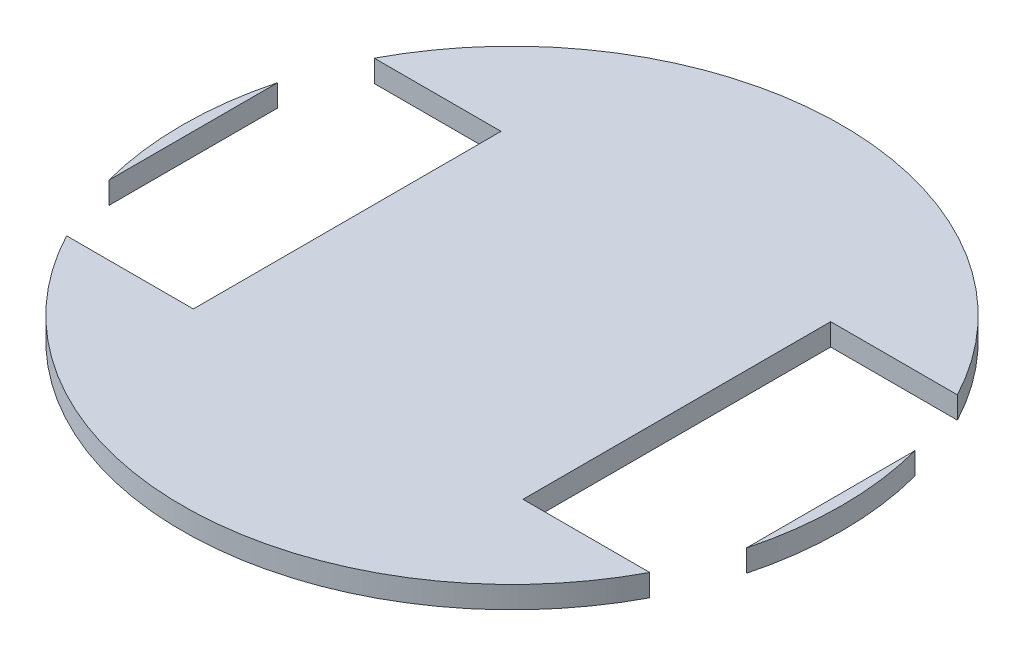
from build123d import *

# Parameters (mm, degrees)
SKETCH1_R           = 75
BOSS_EXTRUDE2_DEPTH = 5
SKETCH5_W           = 35
SKETCH5_H           = 70
CUT_EXTRUDE1_DEPTH  = 107.183802908


with BuildPart() as part:
    # Sketch1 → Boss-Extrude2 (new body)
    with BuildSketch(Plane(origin=(0, 0, 0), x_dir=(1, 0, 0), z_dir=(0, 1, 0))):
        Circle(SKETCH1_R)
    extrude(amount=BOSS_EXTRUDE2_DEPTH)

    # Sketch5 → Cut-Extrude1 (cut, through all)
    with BuildSketch(Plane(origin=(0, 5, 0), x_dir=(1, 0, 0), z_dir=(0, 1, 0))):
        with Locations((55, 0)):
            Rectangle(SKETCH5_W, SKETCH5_H)
        with Locations((-55, 0)):
            Rectangle(SKETCH5_W, SKETCH5_H)
    extrude(amount=-CUT_EXTRUDE1_DEPTH, mode=Mode.SUBTRACT)


with BuildPart() as cut_extrude1_piece_1:
    # of the separate pieces the step leaves, piece 1, a body of its own (cut_extrude1_pieces)
    add(part.part.solids().sort_by_distance((66.332495807, 0, -35))[0])


with BuildPart() as cut_extrude1_piece_2:
    # of the separate pieces the step leaves, piece 2, a body of its own (cut_extrude1_pieces)
    add(part.part.solids().sort_by_distance((72.5, 0, 19.20286437))[0])


with BuildPart() as cut_extrude1_piece_3:
    # of the separate pieces the step leaves, piece 3, a body of its own (cut_extrude1_pieces)
    add(part.part.solids().sort_by_distance((-72.5, 0, -19.20286437))[0])


solid = Compound([cut_extrude1_piece_1.part, cut_extrude1_piece_2.part, cut_extrude1_piece_3.part])
